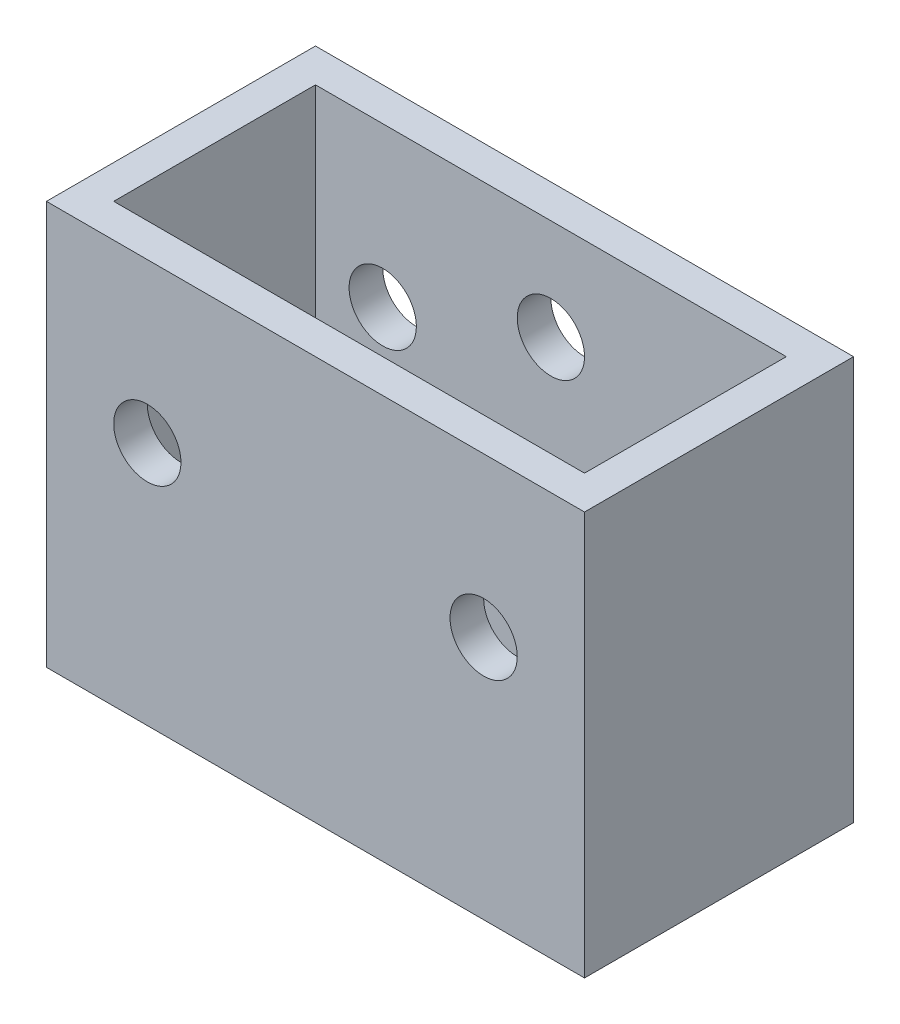
from build123d import *

# Parameters (mm, degrees)
SKETCH1_W           = 50.8
SKETCH1_H           = 25.4
SKETCH1_W_2         = 44.45
SKETCH1_H_2         = 19.05
BOSS_EXTRUDE1_DEPTH = 38.1
CUT_EXTRUDE1_REACH  = 54.363
SKETCH2_R           = 3.175
SKETCH3_R           = 3.175
CUT_EXTRUDE2_DEPTH  = 53.363441445


with BuildPart() as part:
    # Sketch1 → Boss-Extrude1 (new body)
    with BuildSketch(Plane(origin=(0, 0, 0), x_dir=(1, 0, 0), z_dir=(0, 1, 0))):
        Rectangle(SKETCH1_W, SKETCH1_H)
        Rectangle(SKETCH1_W_2, SKETCH1_H_2, mode=Mode.SUBTRACT)
    extrude(amount=BOSS_EXTRUDE1_DEPTH)

    # Sketch2 → Cut-Extrude1 (cut, up to next)
    with BuildSketch(Plane(origin=(0, 0, -12.7), x_dir=(-1, 0, 0), z_dir=(0, 0, -1)), mode=Mode.PRIVATE) as cut_extrude1_sk1:
        with Locations((0, 28.575)):
            Circle(SKETCH2_R)
    cut_extrude1_tool1 = extrude(cut_extrude1_sk1.sketch, amount=-CUT_EXTRUDE1_REACH, mode=Mode.PRIVATE) & part.part
    # Sketch2 → Cut-Extrude1 (cut, up to next)
    with BuildSketch(Plane(origin=(0, 0, -12.7), x_dir=(-1, 0, 0), z_dir=(0, 0, -1)), mode=Mode.PRIVATE) as cut_extrude1_sk2:
        with Locations((0, 9.525)):
            Circle(SKETCH2_R)
    cut_extrude1_tool2 = extrude(cut_extrude1_sk2.sketch, amount=-CUT_EXTRUDE1_REACH, mode=Mode.PRIVATE) & part.part
    add(cut_extrude1_tool1.solids().sort_by_distance((0, 28.575, -12.7))[0], mode=Mode.SUBTRACT)
    add(cut_extrude1_tool2.solids().sort_by_distance((0, 9.525, -12.7))[0], mode=Mode.SUBTRACT)

    # Sketch3 → Cut-Extrude2 (cut, through all)
    with BuildSketch(Plane.XY.offset(12.7)):
        with Locations((15.875, 23.1)):
            Circle(SKETCH3_R)
        with Locations((-15.875, 23.1)):
            Circle(SKETCH3_R)
    extrude(amount=-CUT_EXTRUDE2_DEPTH, mode=Mode.SUBTRACT)


solid = part.part
